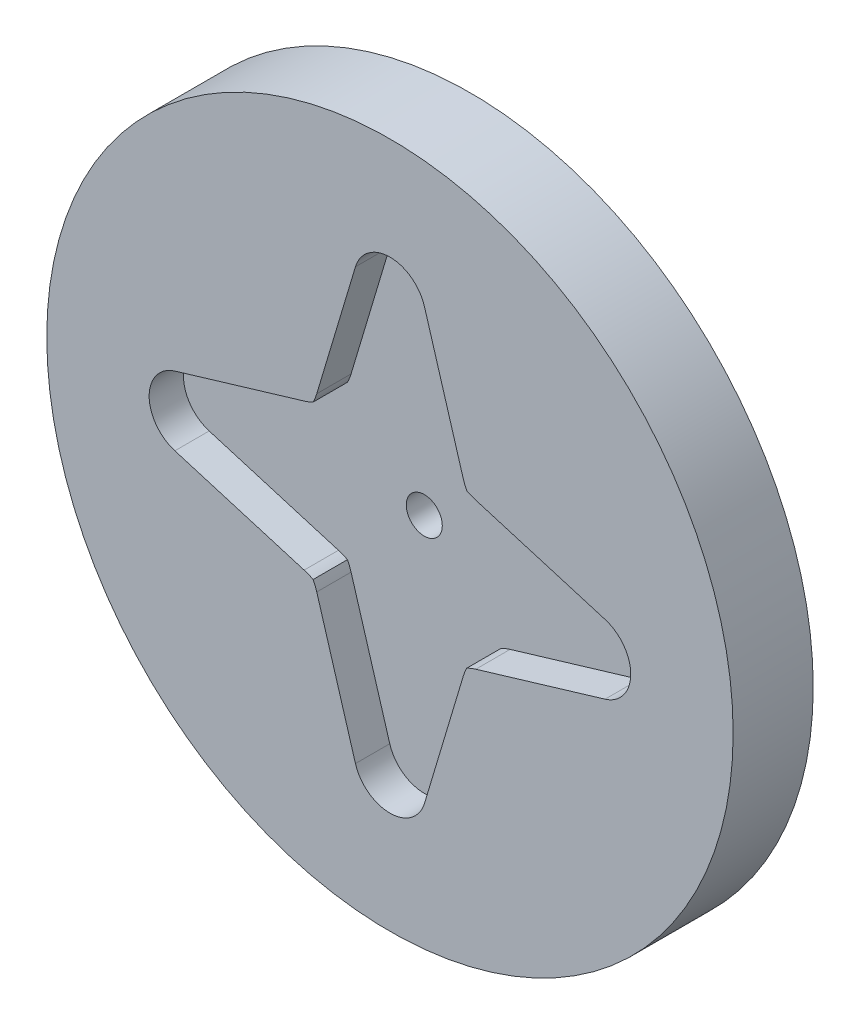
from build123d import *

# Parameters (mm, degrees)
SKETCH1_R           = 19.05
BOSS_EXTRUDE1_DEPTH = 1.905
BOSS_EXTRUDE2_START = -2.54
SKETCH1_3_R         = 19.05
SKETCH1_3_R_2       = 1
BOSS_EXTRUDE2_DEPTH = 2.54


with BuildPart() as part:
    # Sketch1 → Boss-Extrude1 (new body)
    with BuildSketch(Plane.XY):
        Circle(SKETCH1_R)
        with BuildLine():
            ThreePointArc((-11.93963747, -1.916045754), (-13.366253942, 0), (-11.93963747, 1.916045754))
            Line((-11.93963747, 1.916045754), (-4.764046122, 4.063367063))
            ThreePointArc((-4.764046122, 4.063367063), (-4.509341759, 4.152248748), (-4.263651537, 4.263651537))
            ThreePointArc((-4.263651537, 4.263651537), (-4.152248748, 4.509341759), (-4.063367063, 4.764046122))
            Line((-4.063367063, 4.764046122), (-1.916045754, 11.93963747))
            ThreePointArc((-1.916045754, 11.93963747), (0, 13.366253942), (1.916045754, 11.93963747))
            Line((1.916045754, 11.93963747), (4.063367063, 4.764046122))
            ThreePointArc((4.063367063, 4.764046122), (4.152248748, 4.509341759), (4.263651537, 4.263651537))
            ThreePointArc((4.263651537, 4.263651537), (4.509341759, 4.152248748), (4.764046122, 4.063367063))
            Line((4.764046122, 4.063367063), (11.93963747, 1.916045754))
            ThreePointArc((11.93963747, 1.916045754), (12.887927366, 1.297886741), (13.34875896, 0.263958052))
            ThreePointArc((13.34875896, 0.263958052), (13.366253942, 0), (13.34875896, -0.263958052))
            ThreePointArc((13.34875896, -0.263958052), (12.887927366, -1.297886741), (11.93963747, -1.916045754))
            Line((11.93963747, -1.916045754), (4.764046122, -4.063367063))
            ThreePointArc((4.764046122, -4.063367063), (4.509341759, -4.152248748), (4.263651537, -4.263651537))
            ThreePointArc((4.263651537, -4.263651537), (4.152248748, -4.509341759), (4.063367063, -4.764046122))
            Line((4.063367063, -4.764046122), (1.916045754, -11.93963747))
            ThreePointArc((1.916045754, -11.93963747), (0, -13.366253942), (-1.916045754, -11.93963747))
            Line((-1.916045754, -11.93963747), (-4.063367063, -4.764046122))
            ThreePointArc((-4.063367063, -4.764046122), (-4.152248748, -4.509341759), (-4.263651537, -4.263651537))
            ThreePointArc((-4.263651537, -4.263651537), (-4.509341759, -4.152248748), (-4.764046122, -4.063367063))
            Line((-4.764046122, -4.063367063), (-11.93963747, -1.916045754))
        make_face(mode=Mode.SUBTRACT)
    extrude(amount=BOSS_EXTRUDE1_DEPTH)

    # Sketch1<3> → Boss-Extrude2 (add)
    with BuildSketch(Plane.XY.offset(BOSS_EXTRUDE2_START)):
        Circle(SKETCH1_3_R)
        Circle(SKETCH1_3_R_2, mode=Mode.SUBTRACT)
    extrude(amount=BOSS_EXTRUDE2_DEPTH)


solid = part.part
